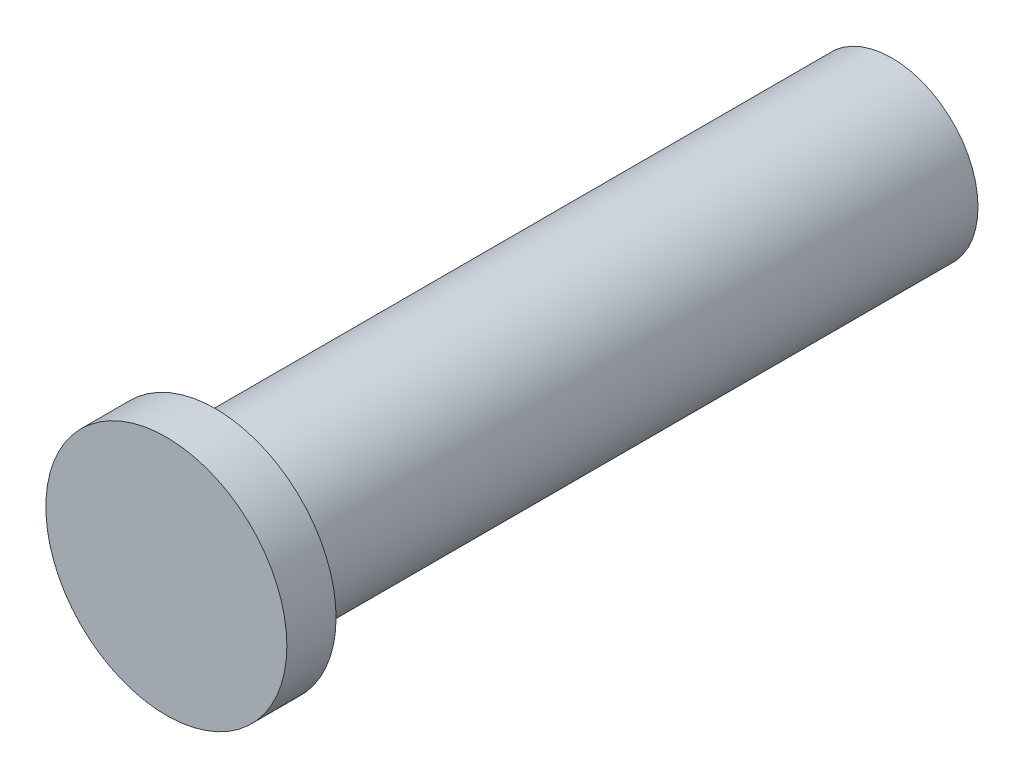
from build123d import *

# Parameters (mm, degrees)
SKETCH1_R           = 7
BOSS_EXTRUDE1_DEPTH = 63
SKETCH2_R           = 9.8
BOSS_EXTRUDE2_DEPTH = 4
SKETCH7_R           = 7
CUT_EXTRUDE2_DEPTH  = 4
SKETCH3_R           = 4.2
CUT_EXTRUDE1_DEPTH  = 15
THREAD1_PITCH       = 1


with BuildPart() as part:
    # Sketch1 → Boss-Extrude1 (new body)
    with BuildSketch(Plane.XY):
        Circle(SKETCH1_R)
    extrude(amount=BOSS_EXTRUDE1_DEPTH)

    # Sketch2 → Boss-Extrude2 (add)
    with BuildSketch(Plane.XY.offset(63)):
        Circle(SKETCH2_R)
    extrude(amount=-BOSS_EXTRUDE2_DEPTH)

    # Sketch7 → Cut-Extrude2 (cut)
    with BuildSketch(Plane(origin=(0, 0, 0), x_dir=(-1, 0, 0), z_dir=(0, 0, -1))):
        Circle(SKETCH7_R)
    extrude(amount=-CUT_EXTRUDE2_DEPTH, mode=Mode.SUBTRACT)

    # Sketch3 → Cut-Extrude1 (cut)
    with BuildSketch(Plane(origin=(0, 0, 4), x_dir=(-1, 0, 0), z_dir=(0, 0, -1))):
        Circle(SKETCH3_R)
    extrude(amount=-CUT_EXTRUDE1_DEPTH, mode=Mode.SUBTRACT)

    # Thread1: the profile of Thread Profile1 profile screwed along a right-hand helix of 15 turns, 8 arcs to a turn; built about Z, then put on its axis
    thread1_z = Axis((0, 0, 0), (0, 0, 1))
    thread1_corners = [(4.1997, 0, -0.000173205), (4.741265875, 0, 0.312499999), (4.741265875, 0, 0.437499999), (4.1997, 0, 0.750173202)]
    with BuildLine(mode=Mode.PRIVATE) as thread1_profile:
        Line(thread1_corners[0], thread1_corners[1])
        Line(thread1_corners[1], thread1_corners[2])
        Line(thread1_corners[2], thread1_corners[3])
        Line(thread1_corners[3], thread1_corners[0])
    thread1_cap = Face(thread1_profile.wire())
    thread1_turn_angles = [0, 22.5, 45, 67.5, 90, 112.5, 135, 157.5, 180, 202.5, 225, 247.5, 270, 292.5, 315, 337.5, 360]
    thread1_turn_weights = [1, 0.9238795325112867, 1, 0.9238795325112867, 1, 0.9238795325112867, 1, 0.9238795325112867, 1, 0.9238795325112867, 1, 0.9238795325112867, 1, 0.9238795325112867, 1, 0.9238795325112867, 1]
    thread1_turn_rails = [Edge.make_bspline([Vector(p[0], p[1], 0).rotate(thread1_z, thread1_turn_angles[k]) / thread1_turn_weights[k] + Vector(0, 0, p[2] + THREAD1_PITCH * thread1_turn_angles[k] / 360) for k in range(17)], [0, 0, 0, 1, 1, 2, 2, 3, 3, 4, 4, 5, 5, 6, 6, 7, 7, 8, 8, 8], 2, thread1_turn_weights) for p in thread1_corners]
    thread1_turn_sides = [Face.make_surface_from_curves(thread1_turn_rails[p[0]], thread1_turn_rails[p[1]]) for p in [(0, 1), (1, 2), (2, 3), (3, 0)]]
    thread1 = Plane(origin=(0, 0, 19), x_dir=(-1, 0, 0), z_dir=(0, 0, -1)) * Solid(Shell([*[p.moved(Location((0, 0, THREAD1_PITCH * i))) for i in range(15) for p in thread1_turn_sides], thread1_cap, thread1_cap.rotate(thread1_z, 5400).moved(Location((0, 0, THREAD1_PITCH * 5400 / 360)))]))
    add(thread1, mode=Mode.SUBTRACT)


solid = part.part
